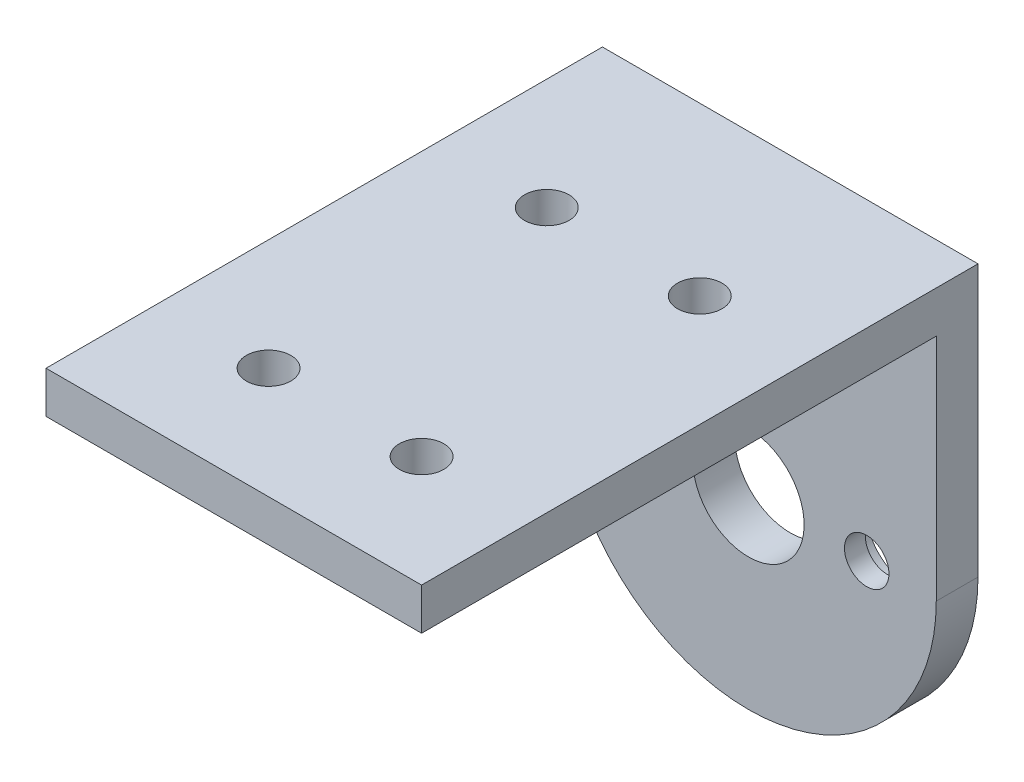
from build123d import *

# Parameters (mm, degrees)
MODEL_R             = 3.5
EXTRUDE_1_DEPTH     = 40
SKETCH_3_W          = 37
SKETCH_3_H          = 37
CUT_EXTRUDE_1_DEPTH = 40
SKETCH_4_R          = 1.5
CUT_EXTRUDE_2_DEPTH = 40
SKETCH1_R           = 4
CUT_EXTRUDE1_DEPTH  = 10
SKETCH2_R           = 1.6
CUT_EXTRUDE2_DEPTH  = 10
SKETCH3_R           = 3
CUT_EXTRUDE3_DEPTH  = 1.5
SKETCH4_R           = 1.6
CUT_EXTRUDE4_DEPTH  = 10


with BuildPart() as part:
    # Model → 凸台-拉伸1 (new body)
    with BuildSketch(Plane.XY):
        with BuildLine():
            Line((2619.766714505, 1592.826425633), (2619.766714505, 1612.326425633))
            Line((2619.766714505, 1612.326425633), (2592.766714505, 1612.326425633))
            Line((2592.766714505, 1612.326425633), (2592.766714505, 1592.826425633))
            ThreePointArc((2592.766714505, 1592.826425633), (2606.266714505, 1579.326425633), (2619.766714505, 1592.826425633))
        make_face()
        with Locations((2606.266714505, 1592.826425633)):
            Circle(MODEL_R, mode=Mode.SUBTRACT)
    extrude(amount=EXTRUDE_1_DEPTH)

    # 草图3 → 切除-拉伸1 (cut)
    with BuildSketch(Plane(origin=(2619.766714505, 0, 0), x_dir=(0, 0, -1), z_dir=(1, 0, 0))):
        with Locations((-21.5, 1590.826425633)):
            Rectangle(SKETCH_3_W, SKETCH_3_H)
    extrude(amount=-CUT_EXTRUDE_1_DEPTH, mode=Mode.SUBTRACT)

    # 草图4 → 切除-拉伸2 (cut)
    with BuildSketch(Plane(origin=(0, 1612.326425633, 0), x_dir=(1, 0, 0), z_dir=(0, 1, 0))):
        with Locations((2600.766714505, -32)):
            Circle(SKETCH_4_R)
        with Locations((2611.766714505, -32)):
            Circle(SKETCH_4_R)
        with Locations((2600.766714505, -12)):
            Circle(SKETCH_4_R)
        with Locations((2611.766714505, -12)):
            Circle(SKETCH_4_R)
    extrude(amount=-CUT_EXTRUDE_2_DEPTH, mode=Mode.SUBTRACT)

    # Sketch1 → Cut-Extrude1 (cut)
    with BuildSketch(Plane(origin=(0, 0, 0), x_dir=(-1, 0, 0), z_dir=(0, 0, -1))):
        with Locations((-2606.266714505, 1592.826425633)):
            Circle(SKETCH1_R)
    extrude(amount=-CUT_EXTRUDE1_DEPTH, mode=Mode.SUBTRACT)

    # Sketch2 → Cut-Extrude2 (cut)
    with BuildSketch(Plane(origin=(0, 0, 0), x_dir=(-1, 0, 0), z_dir=(0, 0, -1))):
        with Locations((-2614.766714505, 1592.826425633)):
            Circle(SKETCH2_R)
        with Locations((-2597.766714505, 1592.826425633)):
            Circle(SKETCH2_R)
    extrude(amount=-CUT_EXTRUDE2_DEPTH, mode=Mode.SUBTRACT)

    # Sketch3 → Cut-Extrude3 (cut)
    with BuildSketch(Plane(origin=(0, 0, 0), x_dir=(-1, 0, 0), z_dir=(0, 0, -1))):
        with Locations((-2597.766714505, 1592.826425633)):
            Circle(SKETCH3_R)
        with Locations((-2614.766714505, 1592.826425633)):
            Circle(SKETCH3_R)
    extrude(amount=-CUT_EXTRUDE3_DEPTH, mode=Mode.SUBTRACT)

    # Sketch4 → Cut-Extrude4 (cut)
    with BuildSketch(Plane(origin=(0, 1612.326425633, 0), x_dir=(1, 0, 0), z_dir=(0, 1, 0))):
        with Locations((2600.766714505, -12)):
            Circle(SKETCH4_R)
        with Locations((2611.766714505, -12)):
            Circle(SKETCH4_R)
        with Locations((2600.766714505, -32)):
            Circle(SKETCH4_R)
        with Locations((2611.766714505, -32)):
            Circle(SKETCH4_R)
    extrude(amount=-CUT_EXTRUDE4_DEPTH, mode=Mode.SUBTRACT)


solid = part.part
